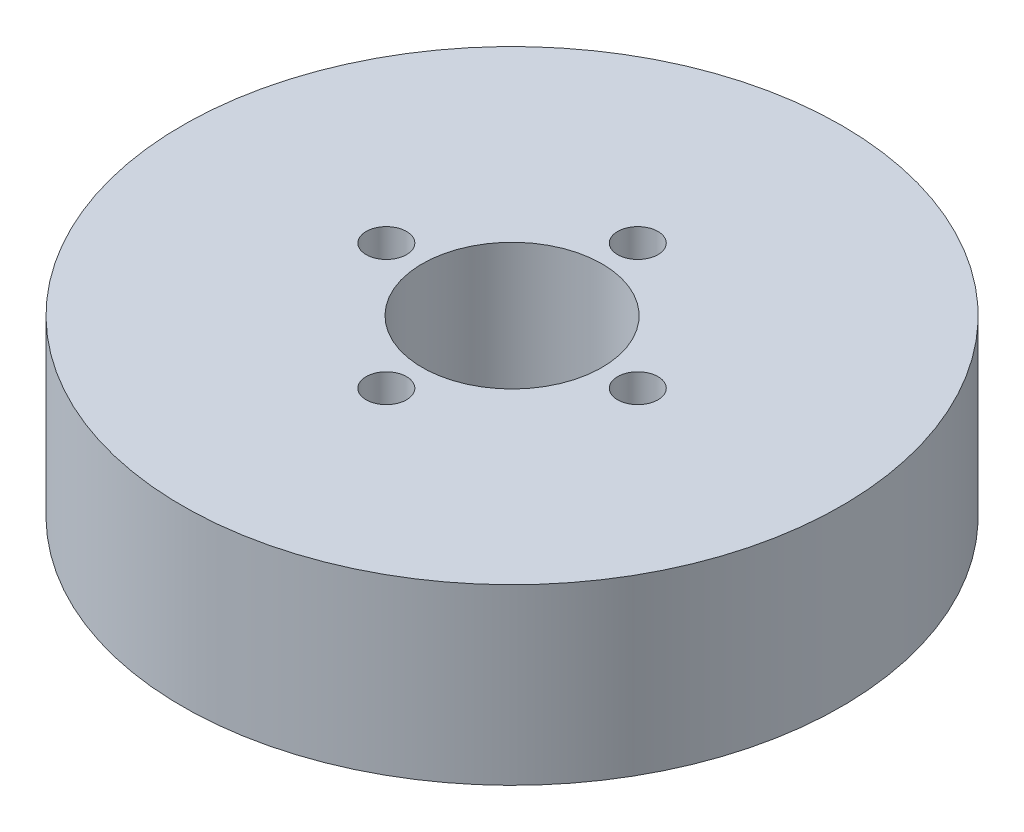
from build123d import *

# Parameters (mm, degrees)
SKETCH1_R           = 55
BOSS_EXTRUDE1_DEPTH = 29
SKETCH2_R           = 15
CUT_EXTRUDE1_DEPTH  = 84.012047318
SKETCH3_R           = 3.366148204
CUT_EXTRUDE2_DEPTH  = 19.242539469
CIRPATTERN1_COUNT   = 4


with BuildPart() as part:
    # Sketch1 → Boss-Extrude1 (new body)
    with BuildSketch(Plane(origin=(0, 0, 0), x_dir=(1, 0, 0), z_dir=(0, 1, 0))):
        Circle(SKETCH1_R)
    extrude(amount=BOSS_EXTRUDE1_DEPTH)

    # Sketch2 → Cut-Extrude1 (cut, through all)
    with BuildSketch(Plane(origin=(0, 0, 0), x_dir=(1, 0, 0), z_dir=(0, 1, 0))):
        Circle(SKETCH2_R)
    extrude(amount=CUT_EXTRUDE1_DEPTH, mode=Mode.SUBTRACT)

    # Sketch3 → Cut-Extrude2 (cut)
    with BuildSketch(Plane(origin=(0, 29, 0), x_dir=(1, 0, 0), z_dir=(0, 1, 0))):
        with Locations((-20.981106944, 0)):
            Circle(SKETCH3_R)
    cut_extrude2 = extrude(amount=-CUT_EXTRUDE2_DEPTH, mode=Mode.SUBTRACT)

    # CirPattern1: Cut-Extrude2 ×4 about axis
    cirpattern1_axis = Axis((0, 0, 0), (0, 1, 0))
    for i in range(1, CIRPATTERN1_COUNT):
        add(cut_extrude2.rotate(cirpattern1_axis, i * 360 / CIRPATTERN1_COUNT), mode=Mode.SUBTRACT)


solid = part.part
